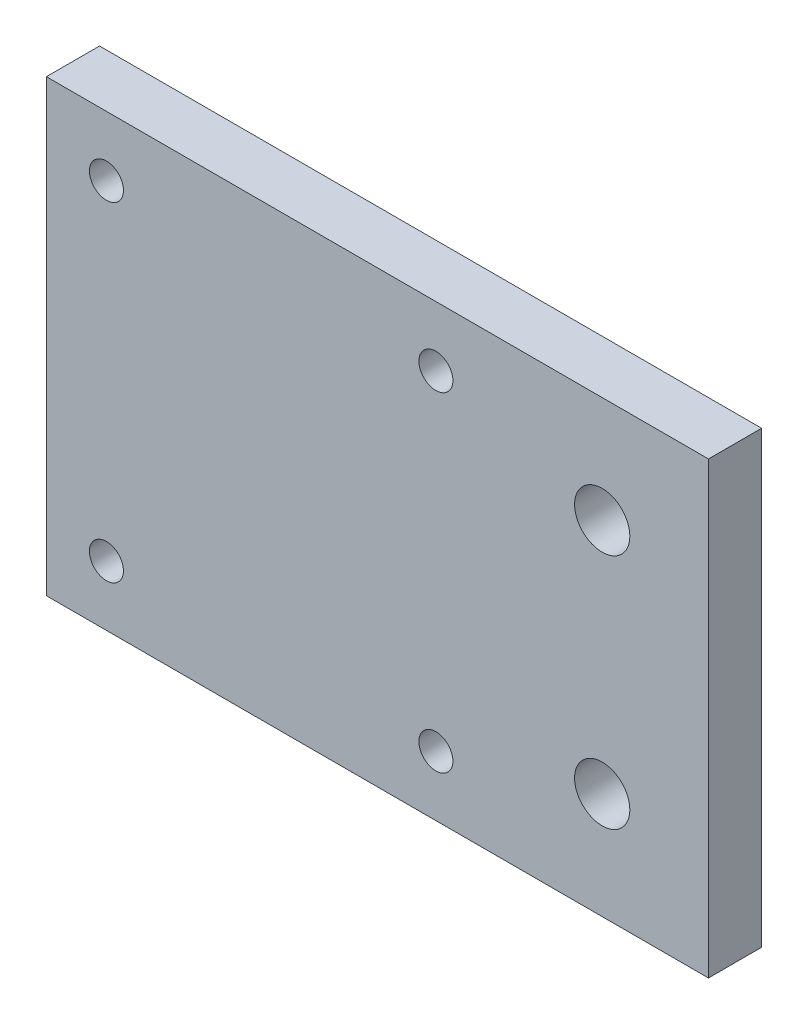
from build123d import *

# Parameters (mm, degrees)
SKETCH2_W           = 62.3
SKETCH2_H           = 42.3
SKETCH2_R           = 1.6
SKETCH2_R_2         = 2.6
BOSS_EXTRUDE1_DEPTH = 5


with BuildPart() as part:
    # Sketch2 → Boss-Extrude1 (new body)
    with BuildSketch(Plane.XY):
        with Locations((10, 0)):
            Rectangle(SKETCH2_W, SKETCH2_H)
        with Locations((-15.5, -15.5)):
            Circle(SKETCH2_R, mode=Mode.SUBTRACT)
        with Locations((15.5, -15.5)):
            Circle(SKETCH2_R, mode=Mode.SUBTRACT)
        with Locations((-15.5, 15.5)):
            Circle(SKETCH2_R, mode=Mode.SUBTRACT)
        with Locations((15.5, 15.5)):
            Circle(SKETCH2_R, mode=Mode.SUBTRACT)
        with Locations((31.15, 11.15)):
            Circle(SKETCH2_R_2, mode=Mode.SUBTRACT)
        with Locations((31.15, -11.15)):
            Circle(SKETCH2_R_2, mode=Mode.SUBTRACT)
    extrude(amount=BOSS_EXTRUDE1_DEPTH)


solid = part.part
